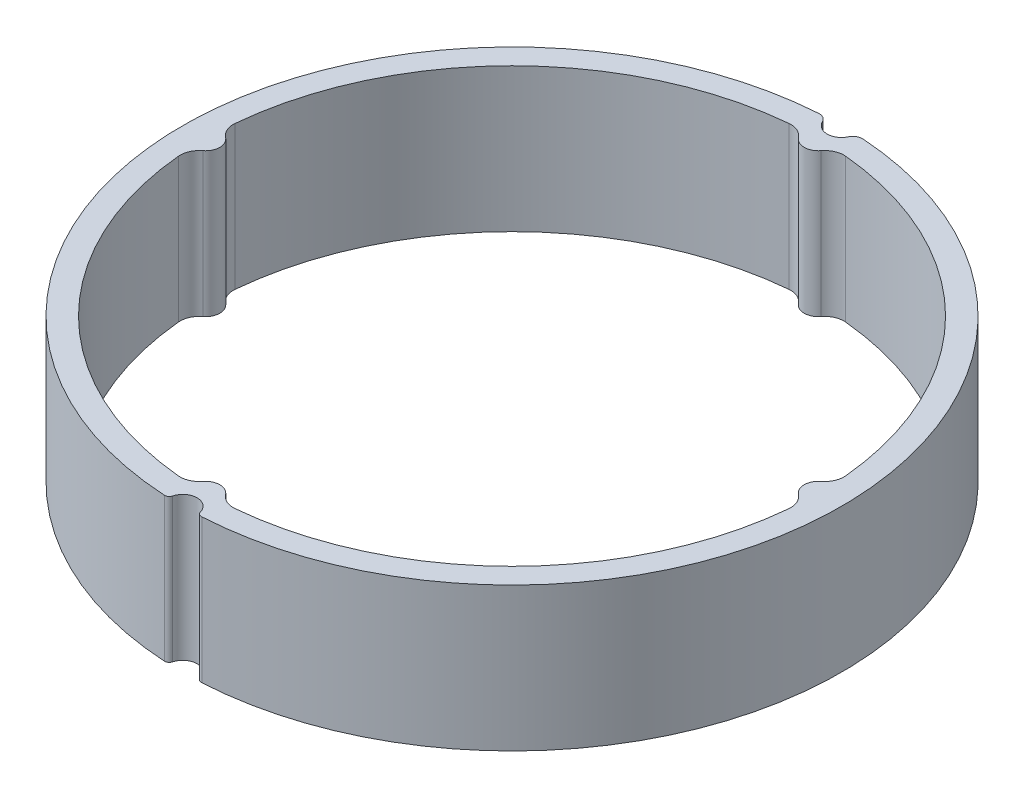
from build123d import *

# Parameters (mm, degrees)
BOSS_EXTRUDE1_DEPTH = 15
CUT_EXTRUDE2_DEPTH  = 51.870447514


with BuildPart() as part:
    # Sketch1 → Boss-Extrude1 (new body)
    with BuildSketch(Plane(origin=(0, 0, 0), x_dir=(1, 0, 0), z_dir=(0, 1, 0))):
        with BuildLine():
            ThreePointArc((1.44754887, -33.974076358), (1.637799872, -34.248697216), (1.958532197, -34.342200344))
            ThreePointArc((1.958532197, -34.342200344), (26.514769668, -21.914362717), (34.099100008, 4.541976411))
            ThreePointArc((34.099100008, 4.541976411), (23.524427548, 25.101030823), (2.324274033, 34.323389898))
            ThreePointArc((2.324274033, 34.323389898), (1.751887793, 34.188899653), (1.354024757, 33.755980911))
            ThreePointArc((1.354024757, 33.755980911), (0, 32.901439631), (-1.354024757, 33.755980911))
            ThreePointArc((-1.354024757, 33.755980911), (-1.751887793, 34.188899653), (-2.324274033, 34.323389898))
            ThreePointArc((-2.324274033, 34.323389898), (-23.524427548, 25.101030823), (-34.099100008, 4.541976411))
            ThreePointArc((-34.099100008, 4.541976411), (-26.514769668, -21.914362717), (-1.958532197, -34.342200344))
            ThreePointArc((-1.958532197, -34.342200344), (-1.637799872, -34.248697216), (-1.44754887, -33.974076358))
            ThreePointArc((-1.44754887, -33.974076358), (0, -32.867271309), (1.44754887, -33.974076358))
        make_face()
        with BuildLine():
            Line((-2.417, 3.787737139), (0, 3.787737139))
            Line((0, 3.787737139), (2.417, 3.787737139))
            ThreePointArc((2.417, 3.787737139), (0, -4.489512172), (-2.417, 3.787737139))
        make_face(mode=Mode.SUBTRACT)
    extrude(amount=BOSS_EXTRUDE1_DEPTH)

    # Sketch2 → Cut-Extrude2 (cut, through all)
    with BuildSketch(Plane(origin=(0, 0, 0), x_dir=(1, 0, 0), z_dir=(0, 1, 0))):
        with BuildLine():
            ThreePointArc((-31.8625, -2.963291034), (-22.627416998, -22.627416998), (-2.963291034, -31.8625))
            ThreePointArc((-2.963291034, -31.8625), (-1.977020771, -31.703659042), (-1.190608005, -31.087611607))
            ThreePointArc((-1.190608005, -31.087611607), (0, -30.5), (1.190608005, -31.087611607))
            ThreePointArc((1.190608005, -31.087611607), (1.977020771, -31.703659042), (2.963291034, -31.8625))
            ThreePointArc((2.963291034, -31.8625), (22.627416998, -22.627416998), (31.8625, -2.963291034))
            ThreePointArc((31.8625, -2.963291034), (31.703659042, -1.977020771), (31.087611607, -1.190608005))
            ThreePointArc((31.087611607, -1.190608005), (30.5, 0), (31.087611607, 1.190608005))
            ThreePointArc((31.087611607, 1.190608005), (31.703659042, 1.977020771), (31.8625, 2.963291034))
            ThreePointArc((31.8625, 2.963291034), (22.627416998, 22.627416998), (2.963291034, 31.8625))
            ThreePointArc((2.963291034, 31.8625), (1.977020771, 31.703659042), (1.190608005, 31.087611607))
            ThreePointArc((1.190608005, 31.087611607), (0, 30.5), (-1.190608005, 31.087611607))
            ThreePointArc((-1.190608005, 31.087611607), (-1.977020771, 31.703659042), (-2.963291034, 31.8625))
            ThreePointArc((-2.963291034, 31.8625), (-22.627416998, 22.627416998), (-31.8625, 2.963291034))
            ThreePointArc((-31.8625, 2.963291034), (-31.703659042, 1.977020771), (-31.087611607, 1.190608005))
            ThreePointArc((-31.087611607, 1.190608005), (-30.5, 0), (-31.087611607, -1.190608005))
            ThreePointArc((-31.087611607, -1.190608005), (-31.703659042, -1.977020771), (-31.8625, -2.963291034))
        make_face()
    extrude(amount=CUT_EXTRUDE2_DEPTH, mode=Mode.SUBTRACT)


solid = part.part
